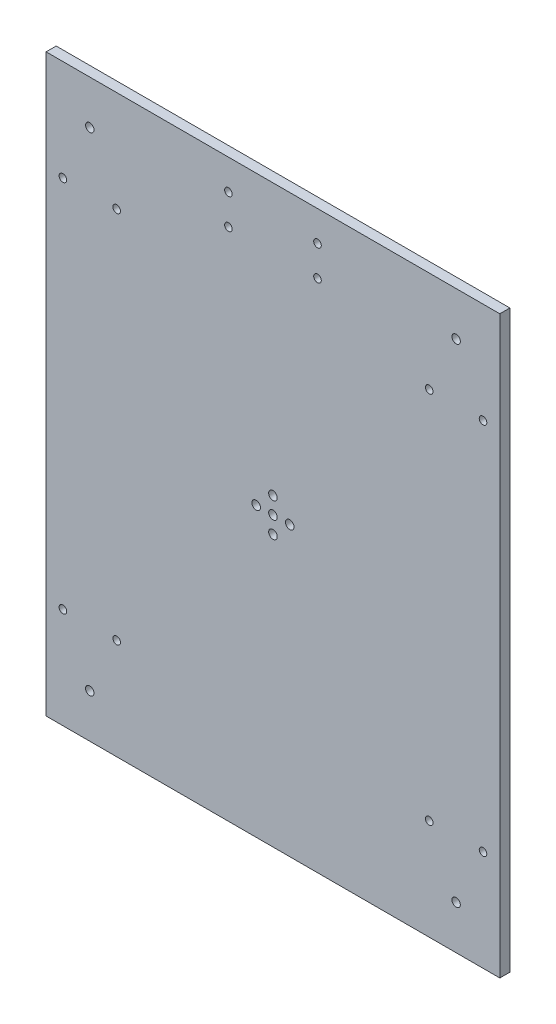
from build123d import *

# Parameters (mm, degrees)
SKETCH_3_W                  = 270
SKETCH_3_H                  = 342.3
SKETCH_3_R                  = 2.55
EXTRUDE_1_DEPTH             = 6
SKETCH_4_R                  = 2.5
CUT_EXTRUDE_1_DEPTH         = 219.06724307
PATTERN_LINEAR_1_COUNT      = 2
PATTERN_LINEAR_1_PITCH      = 218
PATTERN_LINEAR_1_COUNT_DIR2 = 2
PATTERN_LINEAR_1_PITCH_DIR2 = 290.3
SKETCH_7_R                  = 2.25
CUT_EXTRUDE_2_DEPTH         = 219.06724307
SKETCH_8_R                  = 2.25
CUT_EXTRUDE_3_DEPTH         = 219.06724307
PATTERN_LINEAR_2_COUNT      = 2
PATTERN_LINEAR_2_PITCH      = 222.3
PATTERN_LINEAR_2_COUNT_DIR2 = 2
PATTERN_LINEAR_2_PITCH_DIR2 = 218


with BuildPart() as part:
    # Эскиз3 → Бобышка-Вытянуть1 (new body)
    with BuildSketch(Plane.XY):
        Rectangle(SKETCH_3_W, SKETCH_3_H)
        Circle(SKETCH_3_R, mode=Mode.SUBTRACT)
        with Locations((0, 10)):
            Circle(SKETCH_3_R, mode=Mode.SUBTRACT)
        with Locations((10, 0)):
            Circle(SKETCH_3_R, mode=Mode.SUBTRACT)
        with Locations((0, -10)):
            Circle(SKETCH_3_R, mode=Mode.SUBTRACT)
        with Locations((-10, 0)):
            Circle(SKETCH_3_R, mode=Mode.SUBTRACT)
    extrude(amount=EXTRUDE_1_DEPTH)

    # Эскиз4 → Вырез-Вытянуть1 (cut, through all)
    with BuildSketch(Plane.XY.offset(6)):
        with Locations((-109, 145.15)):
            Circle(SKETCH_4_R)
    cut_extrude_1 = extrude(amount=-CUT_EXTRUDE_1_DEPTH, mode=Mode.SUBTRACT)

    # Линейный массив1: Cut-Extrude 1 2 × 2
    with Locations(*[(i * PATTERN_LINEAR_1_PITCH, -j * PATTERN_LINEAR_1_PITCH_DIR2, 0) for i in range(PATTERN_LINEAR_1_COUNT) for j in range(PATTERN_LINEAR_1_COUNT_DIR2) if (i, j) != (0, 0)]):
        add(cut_extrude_1, mode=Mode.SUBTRACT)

    # Эскиз7 → Вырез-Вытянуть2 (cut, through all)
    with BuildSketch(Plane(origin=(0, 0, 0), x_dir=(-1, 0, 0), z_dir=(0, 0, -1))):
        with Locations((-26.5, 153.15)):
            Circle(SKETCH_7_R)
        with Locations((26.5, 153.15)):
            Circle(SKETCH_7_R)
        with Locations((-26.5, 135.15)):
            Circle(SKETCH_7_R)
        with Locations((26.5, 135.15)):
            Circle(SKETCH_7_R)
    extrude(amount=-CUT_EXTRUDE_2_DEPTH, mode=Mode.SUBTRACT)

    # Эскиз8 → Вырез-Вытянуть3 (cut, through all)
    with BuildSketch(Plane(origin=(0, 0, 0), x_dir=(-1, 0, 0), z_dir=(0, 0, -1))):
        with Locations((93, 111.15)):
            Circle(SKETCH_8_R)
        with Locations((125, 111.15)):
            Circle(SKETCH_8_R)
    cut_extrude_3 = extrude(amount=-CUT_EXTRUDE_3_DEPTH, mode=Mode.SUBTRACT)

    # Линейный массив2: Cut-Extrude 3 2 × 2
    with Locations(*[(j * PATTERN_LINEAR_2_PITCH_DIR2, -i * PATTERN_LINEAR_2_PITCH, 0) for i in range(PATTERN_LINEAR_2_COUNT) for j in range(PATTERN_LINEAR_2_COUNT_DIR2) if (i, j) != (0, 0)]):
        add(cut_extrude_3, mode=Mode.SUBTRACT)


solid = part.part
